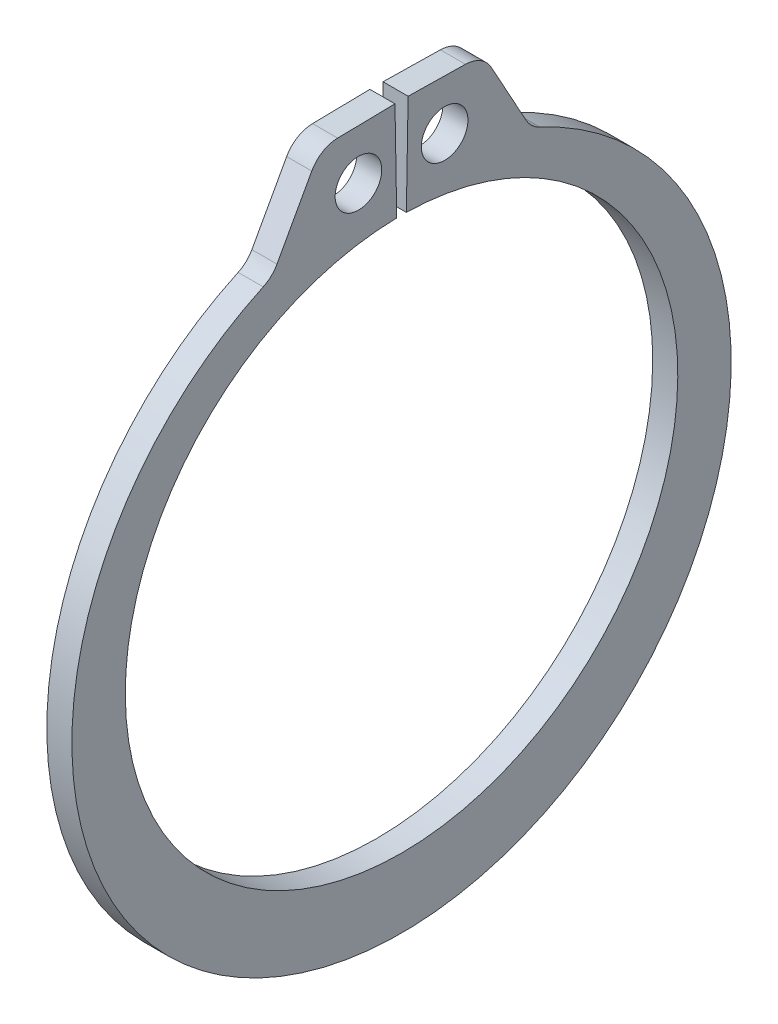
from build123d import *

# Parameters (mm, degrees)
SKETCH1_R      = 0.9906
EXTRUDE1_DEPTH = 0.5334
FILLET1_R      = 1.2827


with BuildPart() as part:
    # Sketch1 → Extrude1 (new, symmetric)
    with BuildSketch(Plane(origin=(0, 0, 0), x_dir=(0, 0, -1), z_dir=(1, 0, 0))):
        with BuildLine():
            Line((-0.205022145, 11.745710799), (-0.279051762, 15.986864752))
            Line((-0.279051762, 15.986864752), (-3.459917227, 15.931342539))
            Line((-3.459917227, 15.931342539), (-5.505255869, 12.215234753))
            ThreePointArc((-5.505255869, 12.215234753), (0, -14.6939), (5.505255869, 12.215234753))
            Line((5.505255869, 12.215234753), (3.459917227, 15.931342539))
            Line((3.459917227, 15.931342539), (0.279051762, 15.986864752))
            Line((0.279051762, 15.986864752), (0.205022145, 11.745710799))
            ThreePointArc((0.205022145, 11.745710799), (0, -11.7475), (-0.205022145, 11.745710799))
        make_face()
        with Locations((-1.832469686, 13.838526669)):
            Circle(SKETCH1_R, mode=Mode.SUBTRACT)
        with Locations((1.832469686, 13.838526669)):
            Circle(SKETCH1_R, mode=Mode.SUBTRACT)
    extrude(amount=EXTRUDE1_DEPTH, both=True)

    # Fillet1
    fillet1_edges = [part.edges().sort_by_distance(p)[0] for p in [
        (0, 12.215234753, 5.505255869),
        (0, 12.215234753, -5.505255869),
        (0, 15.931342539, 3.459917227),
        (0, 15.931342539, -3.459917227),
    ]]
    fillet(fillet1_edges, radius=FILLET1_R)


solid = part.part
